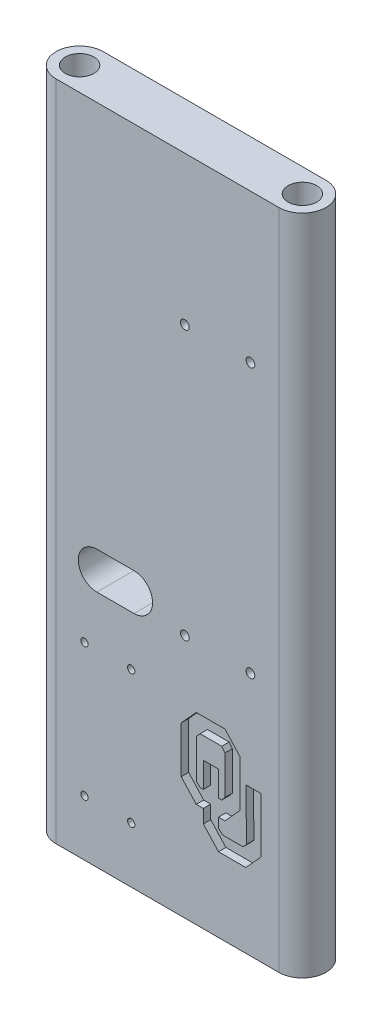
from build123d import *

# Parameters (mm, degrees)
SKETCH1_R               = 4.8895
BOSS_EXTRUDE1_DEPTH     = 226.568
CUT_EXTRUDE2_DEPTH      = 232.785168476
CUT_EXTRUDE2_DEPTH_BACK = 232.785168476
CUT_EXTRUDE3_START      = 5.5245
CUT_EXTRUDE3_DEPTH      = 2.54
CUT_EXTRUDE4_DEPTH      = 232.785168476
CUT_EXTRUDE4_DEPTH_BACK = 8.0645
SKETCH6_R               = 1.5
SKETCH7_R               = 1.25
CUT_EXTRUDE5_DEPTH      = 8.0645


# Read off the part's stored shape, not the designer's step: Cut-Extrude3
with BuildPart() as part:
    # Sketch1 → Boss-Extrude1 (new body)
    with BuildSketch(Plane(origin=(0, 0, 0), x_dir=(1, 0, 0), z_dir=(0, 1, 0))):
        with BuildLine():
            Line((-38.1, 8.0645), (38.1, 8.0645))
            ThreePointArc((38.1, 8.0645), (46.1645, 0), (38.1, -8.0645))
            Line((38.1, -8.0645), (-38.1, -8.0645))
            ThreePointArc((-38.1, -8.0645), (-46.1645, 0), (-38.1, 8.0645))
        make_face()
        with Locations(Location((38.1, 0, 0), (0, 0, 270))):
            Circle(SKETCH1_R, mode=Mode.SUBTRACT)
        with Locations(Location((-38.1, 0, 0), (0, 0, 90))):
            Circle(SKETCH1_R, mode=Mode.SUBTRACT)
    extrude(amount=BOSS_EXTRUDE1_DEPTH)

    # Sketch2 → Cut-Extrude2 (cut, two sides: drawn at the far end of the back side and taken through both)
    with BuildSketch(Plane.XY.offset(8.0645).offset(-CUT_EXTRUDE2_DEPTH_BACK)):
        with BuildLine():
            Line((-24.13, 81.534), (-11.43, 81.534))
            ThreePointArc((-11.43, 81.534), (-5.08, 87.884), (-11.43, 94.234))
            Line((-11.43, 94.234), (-24.13, 94.234))
            ThreePointArc((-24.13, 94.234), (-30.48, 87.884), (-24.13, 81.534))
        make_face()
    extrude(amount=CUT_EXTRUDE2_DEPTH + CUT_EXTRUDE2_DEPTH_BACK, mode=Mode.SUBTRACT)

    # Cut-Extrude3 outline → Cut-Extrude3 (cut)
    with BuildSketch(Plane.XY.offset(CUT_EXTRUDE3_START)):
        Polygon((4.712362594, 41.284608988), (9.865946199, 35.669510433), (12.274110435, 35.669510433), (12.274110435, 31.069950753), (17.460700987, 25.418889406), (26.818871611, 25.418889406), (31.966756262, 31.069950753), (31.966756262, 49.931639685), (26.818871611, 49.931639685), (27.068707369, 32.39069939), (25.865559638, 31.069950753), (18.910545355, 31.069950753), (17.460700987, 32.39069939), (17.460700987, 35.669510433), (19.669379675, 35.669510433), (24.861712029, 41.369363995), (24.861712029, 57.217602301), (19.669379675, 62.874919643), (9.865946199, 62.874919643), (4.712362594, 57.217602301), align=None)
        Polygon((17.460700987, 41.284608988), (17.460700987, 49.931639685), (12.274110435, 49.931639685), (12.274110435, 41.284608988), (11.176923497, 41.284608988), (9.865946199, 42.595586286), (9.865946199, 55.774170995), (11.176923497, 57.217602301), (18.57945551, 57.217602301), (19.669379675, 55.774170995), (19.669379675, 42.595586286), (18.57945551, 41.284608988), align=None, mode=Mode.SUBTRACT)
    extrude(amount=CUT_EXTRUDE3_DEPTH, mode=Mode.SUBTRACT)

    # Sketch6 → Cut-Extrude4 (cut, two sides: drawn at the far end of the back side and taken through both)
    with BuildSketch(Plane.XY.offset(8.0645).offset(-CUT_EXTRUDE4_DEPTH_BACK)):
        with Locations(Location((28.3845, 175.768, 0), (0, 0, 180))):
            Circle(SKETCH6_R)
        with Locations(Location((5.9595, 175.768, 0), (0, 0, 180))):
            Circle(SKETCH6_R)
        with Locations(Location((5.9595, 83.743, 0), (0, 0, 180))):
            Circle(SKETCH6_R)
        with Locations(Location((28.3845, 83.743, 0), (0, 0, 180))):
            Circle(SKETCH6_R)
    extrude(amount=CUT_EXTRUDE4_DEPTH + CUT_EXTRUDE4_DEPTH_BACK, mode=Mode.SUBTRACT)

    # Sketch7 → Cut-Extrude5 (cut)
    with BuildSketch(Plane.XY.offset(8.0645)):
        with Locations((-12.3825, 64.516)):
            Circle(SKETCH7_R)
        with Locations((-28.3845, 64.516)):
            Circle(SKETCH7_R)
        with Locations((-12.3825, 19.05)):
            Circle(SKETCH7_R)
        with Locations((-28.3845, 19.05)):
            Circle(SKETCH7_R)
    extrude(amount=-CUT_EXTRUDE5_DEPTH, mode=Mode.SUBTRACT)


solid = part.part
